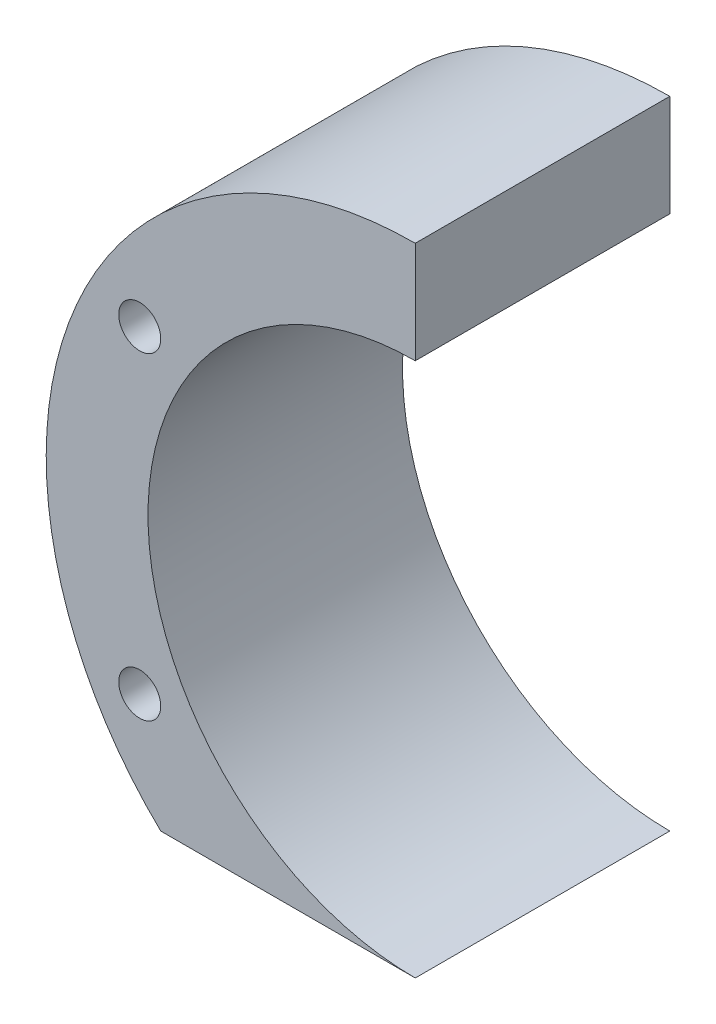
from build123d import *

# Parameters (mm, degrees)
EXTRUDE_2_DEPTH         = 20
SKETCH_3_R              = 1.65
CUT_EXTRUDE_2_DEPTH     = 20
DELETE_FACE_1_OUTLINE_R = 1.65
DELETE_FACE_1_DEPTH     = 20


# Read off the part's stored shape, not the designer's step: 删除面1
with BuildPart() as part:
    # 草图1 → 凸台-拉伸2 (new body)
    with BuildSketch(Plane.XY):
        with BuildLine():
            Line((-20, -21), (0, -21))
            ThreePointArc((0, -21), (-21, 0), (0, 21))
            Line((0, 21), (0, 29))
            ThreePointArc((0, 29), (-26.925824036, 10.770329614), (-20, -21))
        make_face()
    extrude(amount=EXTRUDE_2_DEPTH)

    # 草图3 → 切除-拉伸2 (cut)
    with BuildSketch(Plane.XY):
        with Locations((-12.5, 21.650635095)):
            Circle(SKETCH_3_R)
        with Locations((-21.650635095, 12.5)):
            Circle(SKETCH_3_R)
        with Locations((-21.650635095, -12.5)):
            Circle(SKETCH_3_R)
    extrude(amount=CUT_EXTRUDE_2_DEPTH, mode=Mode.SUBTRACT)

    # Delete Face 1 outline → Delete Face 1 (add)
    with BuildSketch(Plane.XY):
        with Locations((-12.5, 21.650635095)):
            Circle(DELETE_FACE_1_OUTLINE_R)
    extrude(amount=DELETE_FACE_1_DEPTH)


solid = part.part
